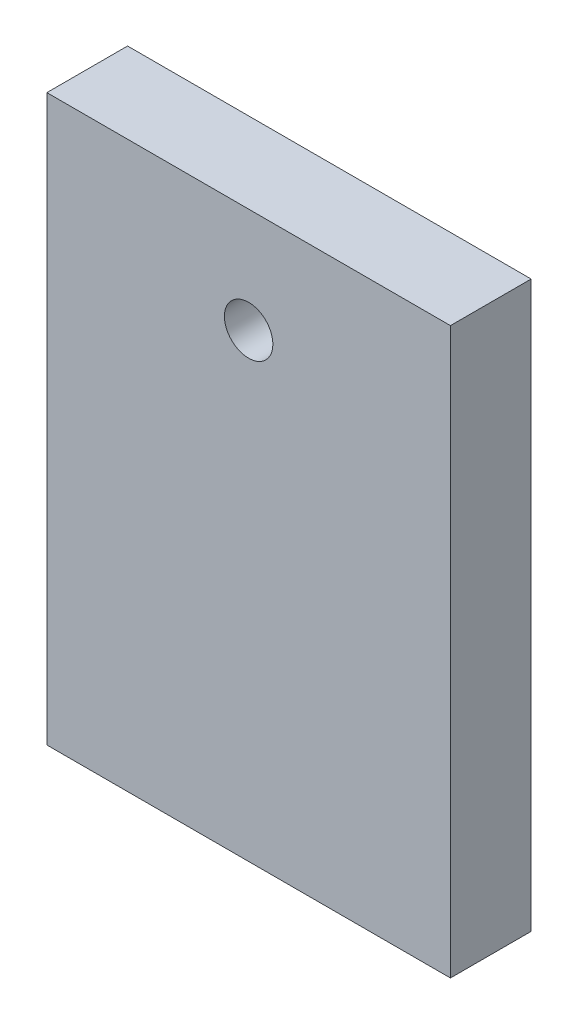
from build123d import *

# Parameters (mm, degrees)
SKETCH2_W           = 25
SKETCH2_H           = 35
BOSS_EXTRUDE1_DEPTH = 5
SKETCH4_R           = 1.5
CUT_EXTRUDE1_DEPTH  = 23.079402166


with BuildPart() as part:
    # Sketch2 → Boss-Extrude1 (new body)
    with BuildSketch(Plane.XY):
        Rectangle(SKETCH2_W, SKETCH2_H)
    extrude(amount=BOSS_EXTRUDE1_DEPTH)

    # Sketch4 → Cut-Extrude1 (cut, through all)
    with BuildSketch(Plane.XY.offset(5)):
        with Locations((0, 11)):
            Circle(SKETCH4_R)
    extrude(amount=-CUT_EXTRUDE1_DEPTH, mode=Mode.SUBTRACT)


solid = part.part
